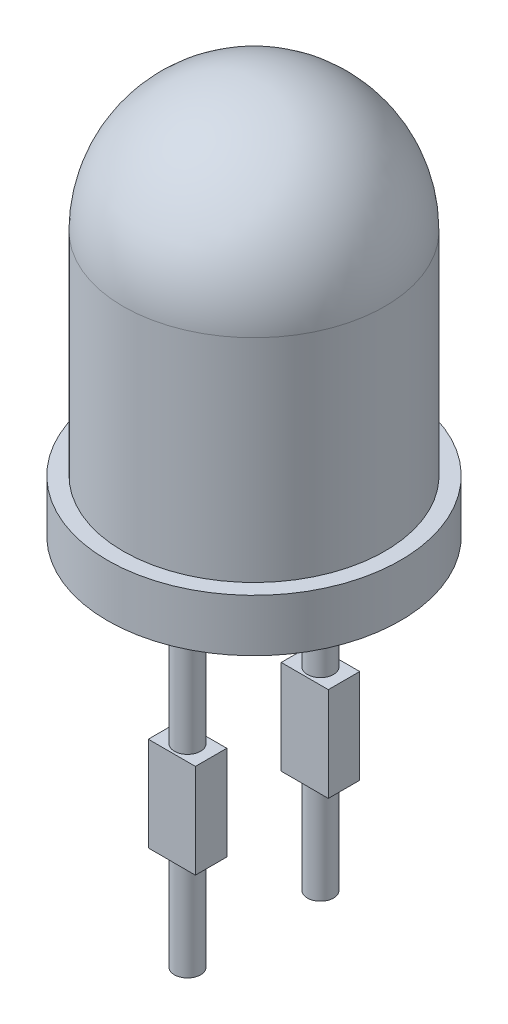
from build123d import *

# Parameters (mm, degrees)
SKETCH2_R               = 0.25
BOSS_EXTRUDE1_DEPTH     = 11
BOSS_EXTRUDE1_2_DEPTH   = 11
SKETCH3_W               = 0.6
SKETCH3_H               = 1.8
BOSS_EXTRUDE2_DEPTH     = 0.45
CUT_EXTRUDE1_DEPTH      = 15.573284633
CUT_EXTRUDE1_DEPTH_BACK = 15.573284633
SKETCH4_W               = 9.223237231
SKETCH4_H               = 6.369410464


with BuildPart() as part:
    # Sketch1 → Revolve1 (revolve)
    with BuildSketch(Plane(origin=(0, 0, 0), x_dir=(0, 0, -1), z_dir=(1, 0, 0))):
        with BuildLine():
            Line((-2.5, 2.025), (-2.5, -2.025))
            Line((-2.5, -2.025), (-2.8, -2.025))
            Line((-2.8, -2.025), (-2.8, -3.025))
            Line((-2.8, -3.025), (0, -3.025))
            Line((0, -3.025), (0, 4.525))
            ThreePointArc((0, 4.525), (-1.767766953, 3.792766953), (-2.5, 2.025))
        make_face()
    revolve(axis=Axis((0, 4.525, 0), (0, -1, 0)))


with BuildPart() as body_2:
    # Sketch2 → Boss-Extrude1 (new body)
    with BuildSketch(Plane.XZ.offset(3.025)):
        with Locations((0, 1.27)):
            Circle(SKETCH2_R)
    extrude(amount=BOSS_EXTRUDE1_DEPTH)



with BuildPart() as body_3:
    # Sketch2 → Boss-Extrude1 2 (new body)
    with BuildSketch(Plane.XZ.offset(3.025)):
        with Locations((0, -1.27)):
            Circle(SKETCH2_R)
    extrude(amount=BOSS_EXTRUDE1_2_DEPTH)


with BuildPart() as body_2_1:
    add(body_2.part)

    add(body_3.part)  # Boss-Extrude2 merges body 3
    # Sketch3 → Boss-Extrude2 (add, symmetric)
    with BuildSketch(Plane(origin=(0, 0, 0), x_dir=(0, 0, -1), z_dir=(1, 0, 0))):
        with Locations((1.27, -6.725)):
            Rectangle(SKETCH3_W, SKETCH3_H)
        with Locations((-1.27, -6.725)):
            Rectangle(SKETCH3_W, SKETCH3_H)
    extrude(amount=BOSS_EXTRUDE2_DEPTH, both=True)

    # Sketch4 → Cut-Extrude1 (cut, two sides: drawn at the far end of the back side and taken through both)
    with BuildSketch(Plane(origin=(0, 0, 0), x_dir=(0, 0, -1), z_dir=(1, 0, 0)).offset(-CUT_EXTRUDE1_DEPTH_BACK)):
        with Locations((0.744476547, -12.709705232)):
            Rectangle(SKETCH4_W, SKETCH4_H)
    extrude(amount=CUT_EXTRUDE1_DEPTH + CUT_EXTRUDE1_DEPTH_BACK, mode=Mode.SUBTRACT)


solid = Compound([part.part, body_2_1.part])
